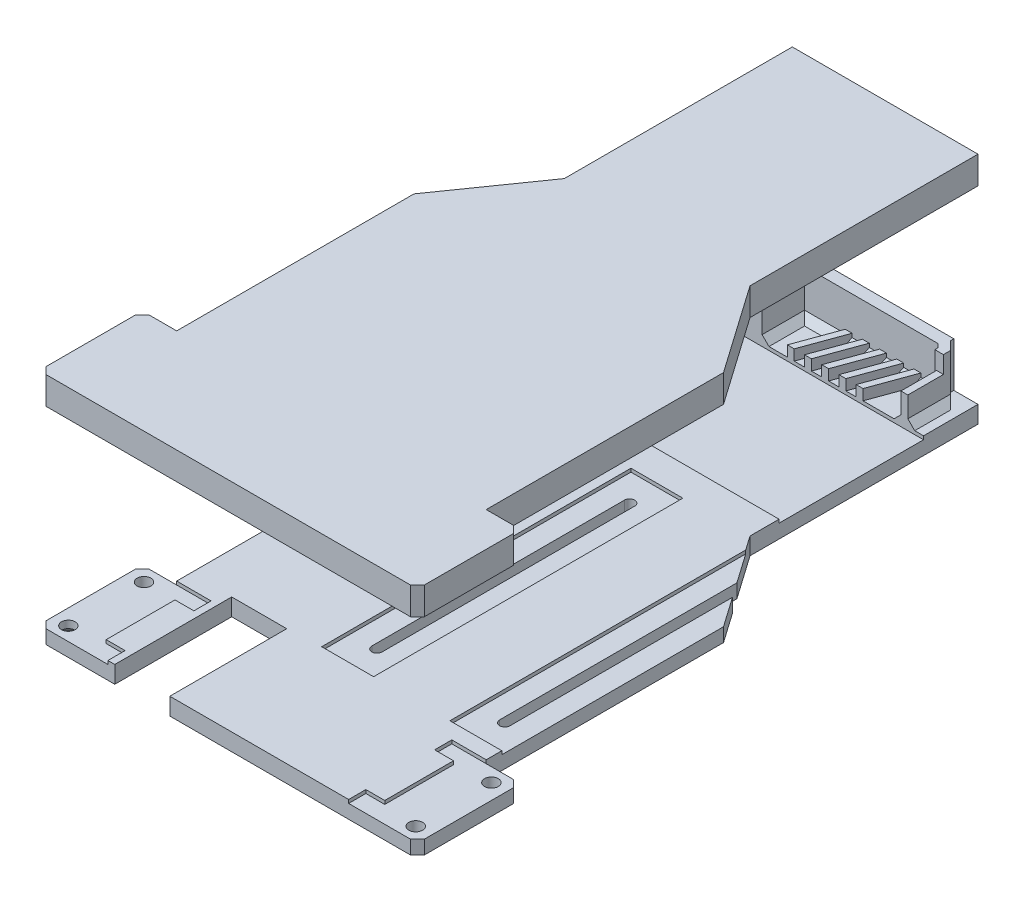
from build123d import *

# Parameters (mm, degrees)
SKETCH1_W                     = 90
SKETCH1_H                     = 190
BOSS_EXTRUDE1_DEPTH           = 5
SKETCH2_W                     = 10
SKETCH2_H                     = 30
BOSS_EXTRUDE2_DEPTH           = 5
CHAMFER1_SIZE                 = 2
SKETCH3_W                     = 16
SKETCH3_H                     = 34
CUT_EXTRUDE1_DEPTH            = 50
SKETCH4_W                     = 90
SKETCH4_H                     = 42
CUT_EXTRUDE2_DEPTH            = 1
SKETCH7_W                     = 15.1
SKETCH7_H                     = 89.916335477
CUT_EXTRUDE7_DEPTH            = 1
BOSS_EXTRUDE4_START           = 5
BOSS_EXTRUDE4_DEPTH           = 13
BOSS_EXTRUDE5_DEPTH           = 3.1
CUT_EXTRUDE11_START           = 5
CUT_EXTRUDE11_DEPTH           = 1
CUT_EXTRUDE12_DEPTH           = 112.23848255
CUT_EXTRUDE12_DEPTH_BACK      = 112.23848255
BOSS_EXTRUDE6_DEPTH           = 1
CHAMFER4_SIZE                 = 2
CUT_EXTRUDE13_REACH           = 114.094
SKETCH23_R                    = 2
CUT_EXTRUDE14_DEPTH           = 113.093556715
CUT_EXTRUDE14_DEPTH_BACK      = 113.093556715
SKETCH26_R                    = 3.8
CUT_EXTRUDE15_DEPTH           = 2.5
CUT_EXTRUDE15_TAPER           = 44
CUT_EXTRUDE15_OTHER_WAY_DEPTH = 113.093556715
SKETCH27_W                    = 2.002698481
SKETCH27_H                    = 10.340179912
BOSS_EXTRUDE7_DEPTH           = 8
CHAMFER5_SIZE                 = 2
CHAMFER6_SIZE                 = 15.045922045
CHAMFER6_SIZE_2               = 4.6
CHAMFER7_SIZE                 = 2
BOSS_EXTRUDE8_START           = 60
BOSS_EXTRUDE8_DEPTH           = 8


with BuildPart() as part:
    # Sketch1 → Boss-Extrude1 (new body)
    with BuildSketch(Plane(origin=(0, 0, 0), x_dir=(1, 0, 0), z_dir=(0, 1, 0))):
        Rectangle(SKETCH1_W, SKETCH1_H)
    extrude(amount=BOSS_EXTRUDE1_DEPTH)

    # Sketch2 → Boss-Extrude2 (add)
    with BuildSketch(Plane(origin=(0, 0, 0), x_dir=(1, 0, 0), z_dir=(0, 1, 0))):
        with Locations((-50, -80)):
            Rectangle(SKETCH2_W, SKETCH2_H)
        with Locations((50, -80)):
            Rectangle(SKETCH2_W, SKETCH2_H)
    extrude(amount=BOSS_EXTRUDE2_DEPTH)

    # Chamfer1
    chamfer1_edges = [part.edges().sort_by_distance(p)[0] for p in [
        (-55, 2.5, 65),
        (-55, 2.5, 95),
        (55, 2.5, 95),
        (55, 2.5, 65),
    ]]
    chamfer(chamfer1_edges, length=CHAMFER1_SIZE)

    # Sketch3 → Cut-Extrude1 (cut)
    with BuildSketch(Plane(origin=(0, 5, 0), x_dir=(1, 0, 0), z_dir=(0, 1, 0))):
        with Locations((-25, -78)):
            Rectangle(SKETCH3_W, SKETCH3_H)
    extrude(amount=-CUT_EXTRUDE1_DEPTH, mode=Mode.SUBTRACT)

    # Sketch4 → Cut-Extrude2 (cut)
    with BuildSketch(Plane(origin=(0, 5, 0), x_dir=(1, 0, 0), z_dir=(0, 1, 0))):
        with Locations((0, 59.159820088)):
            Rectangle(SKETCH4_W, SKETCH4_H)
    extrude(amount=-CUT_EXTRUDE2_DEPTH, mode=Mode.SUBTRACT)

    # Sketch7 → Cut-Extrude7 (cut)
    with BuildSketch(Plane(origin=(0, 5, 0), x_dir=(1, 0, 0), z_dir=(0, 1, 0))):
        with Locations((37.45, -15.495273531)):
            Rectangle(SKETCH7_W, SKETCH7_H)
        with Locations((0.16773297, -15.495273531)):
            Rectangle(SKETCH7_W, SKETCH7_H)
    extrude(amount=-CUT_EXTRUDE7_DEPTH, mode=Mode.SUBTRACT)

    # Sketch17 → Boss-Extrude4 (add)
    with BuildSketch(Plane(origin=(0, 0, 0), x_dir=(1, 0, 0), z_dir=(0, 1, 0)).offset(BOSS_EXTRUDE4_START)):
        Polygon((-22.440023983, 80.159820088), (-19.940023983, 80.159820088), (-19.940023983, 92.499820088), (18.940023983, 92.499820088), (19.940023983, 91.499820088), (19.940023983, 90.5), (22.440023983, 90.5), (22.440023983, 92.535353994), (19.975557889, 94.999820088), (-22.440023983, 94.999820088), align=None)
    extrude(amount=BOSS_EXTRUDE4_DEPTH)

    # Sketch18 → Boss-Extrude5 (add)
    with BuildSketch(Plane(origin=(0, 5, 0), x_dir=(1, 0, 0), z_dir=(0, 1, 0))):
        Polygon((-12.599634528, 80.159820088), (-10.599634528, 80.159820088), (-6.108241837, 92.499820088), (-8.108241837, 92.499820088), align=None)
        Polygon((-3.108241837, 92.499820088), (-7.599634528, 80.159820088), (-5.599634528, 80.159820088), (-1.108241837, 92.499820088), align=None)
        Polygon((1.891758163, 92.499820088), (-2.599634528, 80.159820088), (-0.599634528, 80.159820088), (3.891758163, 92.499820088), align=None)
        Polygon((6.891758163, 92.499820088), (2.400365472, 80.159820088), (4.400365472, 80.159820088), (8.891758163, 92.499820088), align=None)
        Polygon((11.891758163, 92.499820088), (7.400365472, 80.159820088), (9.400365472, 80.159820088), (13.891758163, 92.499820088), align=None)
    extrude(amount=BOSS_EXTRUDE5_DEPTH)

    # Sketch19 → Cut-Extrude11 (cut)
    with BuildSketch(Plane(origin=(0, 0, 0), x_dir=(1, 0, 0), z_dir=(0, 1, 0)).offset(CUT_EXTRUDE11_START)):
        Polygon((-35, -65), (-35, -70), (-40.5, -70), (-40.5, -90), (-35, -90), (-35, -95), (-53, -95), (-55, -93), (-55, -67), (-53, -65), align=None)
    cut_extrude11 = extrude(amount=-CUT_EXTRUDE11_DEPTH, mode=Mode.SUBTRACT)

    # Mirror1: Cut-Extrude11 across plane
    add(cut_extrude11.mirror(Plane(origin=(0, 0, 0), x_dir=(0, 0, 1), z_dir=(1, 0, 0))), mode=Mode.SUBTRACT)

    # Sketch20 → Cut-Extrude12 (cut, two sides: drawn at the far end of the back side and taken through both)
    with BuildSketch(Plane(origin=(0, 0, 0), x_dir=(1, 0, 0), z_dir=(0, 1, 0)).offset(-CUT_EXTRUDE12_DEPTH_BACK)):
        Polygon((-27, 29.706664121), (-45, 4), (-45, 95), (-27, 95), align=None)
        Polygon((27, 95), (27, 29.706664121), (45, 4), (45, 95), align=None)
    extrude(amount=CUT_EXTRUDE12_DEPTH + CUT_EXTRUDE12_DEPTH_BACK, mode=Mode.SUBTRACT)

    # Sketch22 → Boss-Extrude6 (add)
    with BuildSketch(Plane(origin=(0, 0, -94.999820088), x_dir=(-1, 0, 0), z_dir=(0, 0, -1))):
        Polygon((-19.975557889, 5), (-27, 5), (-27, 0), (27, 0), (27, 5), (22.440023983, 5), (22.440023983, 18), (-19.975557889, 18), align=None)
    extrude(amount=BOSS_EXTRUDE6_DEPTH)

    # Chamfer4
    chamfer4_edges = [part.edges().sort_by_distance(p)[0] for p in [
        (-19.940023983, 5, -86.329820088),
        (-14.02413291, 5, -92.499820088),
        (-4.608241837, 5, -92.499820088),
        (0.391758163, 5, -92.499820088),
        (5.391758163, 5, -92.499820088),
        (10.391758163, 5, -92.499820088),
    ]]
    chamfer(chamfer4_edges, length=CHAMFER4_SIZE)

    # Sketch23 → Cut-Extrude13 (cut, up to next)
    with BuildSketch(Plane.XZ, mode=Mode.PRIVATE) as cut_extrude13_sk1:
        with Locations(Location((-50.5, 91, 0), (0, 0, 270))):
            Circle(SKETCH23_R)
    cut_extrude13_tool1 = extrude(cut_extrude13_sk1.sketch, amount=-CUT_EXTRUDE13_REACH, mode=Mode.PRIVATE) & part.part
    # Sketch23 → Cut-Extrude13 (cut, up to next)
    with BuildSketch(Plane.XZ, mode=Mode.PRIVATE) as cut_extrude13_sk2:
        with Locations(Location((-50.5, 69, 0), (0, 0, 270))):
            Circle(SKETCH23_R)
    cut_extrude13_tool2 = extrude(cut_extrude13_sk2.sketch, amount=-CUT_EXTRUDE13_REACH, mode=Mode.PRIVATE) & part.part
    # Sketch23 → Cut-Extrude13 (cut, up to next)
    with BuildSketch(Plane.XZ, mode=Mode.PRIVATE) as cut_extrude13_sk3:
        with Locations(Location((50.5, 69, 0), (0, 0, 270))):
            Circle(SKETCH23_R)
    cut_extrude13_tool3 = extrude(cut_extrude13_sk3.sketch, amount=-CUT_EXTRUDE13_REACH, mode=Mode.PRIVATE) & part.part
    # Sketch23 → Cut-Extrude13 (cut, up to next)
    with BuildSketch(Plane.XZ, mode=Mode.PRIVATE) as cut_extrude13_sk4:
        with Locations(Location((50.5, 91, 0), (0, 0, 270))):
            Circle(SKETCH23_R)
    cut_extrude13_tool4 = extrude(cut_extrude13_sk4.sketch, amount=-CUT_EXTRUDE13_REACH, mode=Mode.PRIVATE) & part.part
    add(cut_extrude13_tool1.solids().sort_by_distance((-50.5, 0, 91))[0], mode=Mode.SUBTRACT)
    add(cut_extrude13_tool2.solids().sort_by_distance((-50.5, 0, 69))[0], mode=Mode.SUBTRACT)
    add(cut_extrude13_tool3.solids().sort_by_distance((50.5, 0, 69))[0], mode=Mode.SUBTRACT)
    add(cut_extrude13_tool4.solids().sort_by_distance((50.5, 0, 91))[0], mode=Mode.SUBTRACT)

    # Sketch25 → Cut-Extrude14 (cut, two sides: drawn at the far end of the back side and taken through both)
    with BuildSketch(Plane.XZ.offset(-CUT_EXTRUDE14_DEPTH_BACK)):
        with BuildLine():
            Line((1.71773297, 51.988728589), (1.71773297, -21.462894208))
            ThreePointArc((1.71773297, -21.462894208), (0.21773297, -22.962894208), (-1.28226703, -21.462894208))
            Line((-1.28226703, -21.462894208), (-1.28226703, 51.988728589))
            ThreePointArc((-1.28226703, 51.988728589), (0.21773297, 53.488728589), (1.71773297, 51.988728589))
        make_face()
        with BuildLine():
            Line((38.9, 51.988728589), (38.9, -21.462894208))
            ThreePointArc((38.9, -21.462894208), (37.4, -22.962894208), (35.9, -21.462894208))
            Line((35.9, -21.462894208), (35.9, 51.988728589))
            ThreePointArc((35.9, 51.988728589), (37.4, 53.488728589), (38.9, 51.988728589))
        make_face()
    extrude(amount=CUT_EXTRUDE14_DEPTH + CUT_EXTRUDE14_DEPTH_BACK, mode=Mode.SUBTRACT)

    # Sketch26 → Cut-Extrude15 (cut)
    with BuildSketch(Plane.XZ):
        with Locations((-50.5, 91)):
            Circle(SKETCH26_R)
    extrude(amount=-CUT_EXTRUDE15_DEPTH, taper=CUT_EXTRUDE15_TAPER, mode=Mode.SUBTRACT)

    # Sketch26 → Cut-Extrude15 other way (cut)
    with BuildSketch(Plane.XZ):
        with Locations((-50.5, 91)):
            Circle(SKETCH26_R)
    extrude(amount=CUT_EXTRUDE15_OTHER_WAY_DEPTH, mode=Mode.SUBTRACT)

    # Sketch27 → Boss-Extrude7 (add)
    with BuildSketch(Plane(origin=(0, 5, 0), x_dir=(1, 0, 0), z_dir=(0, 1, 0))):
        with Locations((21.438674742, 85.329910044)):
            Rectangle(SKETCH27_W, SKETCH27_H)
    extrude(amount=BOSS_EXTRUDE7_DEPTH)

    # Chamfer5
    chamfer5_edges = [part.edges().sort_by_distance(p)[0] for p in [
        (22.440023983, 5, -86.347587041),
    ]]
    chamfer(chamfer5_edges, length=CHAMFER5_SIZE)

    # Chamfer6
    # the kernel refuses this chamfer: 15.045922045, 4.6 mm, written as the material it adds along each edge
    with BuildSketch(Plane(origin=(-22.440023983, 5, -80.159820088), x_dir=(0.011263281176818154, 0.9999365672367082, 0), z_dir=(0, 0, -1))) as chamfer6_piece_1_section:
        Polygon((CHAMFER6_SIZE * 0.999936567239, -CHAMFER6_SIZE * 0.0112632811768), (-CHAMFER6_SIZE_2 * 0.0112632811768, -CHAMFER6_SIZE_2 * 0.999936567237), (0, 0), align=None)
    chamfer6_piece_1 = extrude(amount=15.84, mode=Mode.PRIVATE)
    chamfer6_piece_1 = split(chamfer6_piece_1, bisect_by=Plane(origin=(-23.998082586, 18, -88.079820088), z_dir=(0, -1, 0)), keep=Keep.TOP, mode=Mode.PRIVATE)
    chamfer6_piece_1 = split(chamfer6_piece_1, bisect_by=Plane(origin=(-27, 9.852411417, -88.079820088), z_dir=(1, 0, 0)), keep=Keep.TOP, mode=Mode.PRIVATE)
    add(chamfer6_piece_1)

    # Chamfer7
    # the kernel refuses this chamfer: 2 mm, written as the material it adds along each edge
    with BuildSketch(Plane(origin=(8.748392187, 5, -92.499820088), x_dir=(-2.155664593802373e-14, -0.027495876610586414, 0.9996219169112968), z_dir=(1, 0, 0))) as chamfer7_piece_1_section:
        Polygon((CHAMFER7_SIZE * 0.999621916911, -CHAMFER7_SIZE * 0.0274958766106), (-CHAMFER7_SIZE * 0.0274958766106, -CHAMFER7_SIZE * 0.999621916911), (0, 0), align=None)
    chamfer7_piece_1 = extrude(amount=15.334997772, mode=Mode.PRIVATE)
    chamfer7_piece_1 = split(chamfer7_piece_1, bisect_by=Plane(origin=(20.49595334, 8.944070643, -90.499940029), z_dir=(-0.7071067811865476, -0.7071067811865476, -1.2691553730131522e-15)), keep=Keep.TOP, mode=Mode.PRIVATE)
    chamfer7_piece_1 = split(chamfer7_piece_1, bisect_by=Plane(origin=(20.513690307, 5.000059971, -94.46168767), z_dir=(-0.7071067811865465, 0, 0.7071067811865486)), keep=Keep.TOP, mode=Mode.PRIVATE)
    add(chamfer7_piece_1)
    with BuildSketch(Plane(origin=(20.437325502, 5, -80.159820088), x_dir=(-0.9996219169112968, -0.02749587661058651, 0), z_dir=(0, 0, -1))) as chamfer7_piece_2_section:
        Polygon((CHAMFER7_SIZE * 0.999621916911, CHAMFER7_SIZE * 0.0274958766106), (-CHAMFER7_SIZE * 0.0274958766106, CHAMFER7_SIZE * 0.999621916911), (0, 0), align=None)
    chamfer7_piece_2 = extrude(amount=15.483545888, mode=Mode.PRIVATE)
    chamfer7_piece_2 = split(chamfer7_piece_2, bisect_by=Plane(origin=(24.542296211, 5.500899494, -90.433081766), z_dir=(-0.7071067811865465, 0, 0.7071067811865486)), keep=Keep.TOP, mode=Mode.PRIVATE)
    add(chamfer7_piece_2)


with BuildPart() as body_2:
    # Sketch28 → Boss-Extrude8 (new body)
    with BuildSketch(Plane(origin=(0, 0, 0), x_dir=(1, 0, 0), z_dir=(0, 1, 0)).offset(BOSS_EXTRUDE8_START)):
        Polygon((-53, -95), (-55, -93), (-55, -67), (-53, -65), (-45, -65), (-45, 4), (-27, 29.706664121), (-27, 95.999820088), (27, 95.999820088), (27, 29.706664121), (45, 4), (45, -65), (53, -65), (55, -67), (55, -93), (53, -95), align=None)
    extrude(amount=BOSS_EXTRUDE8_DEPTH)


solid = Compound([part.part, body_2.part])
